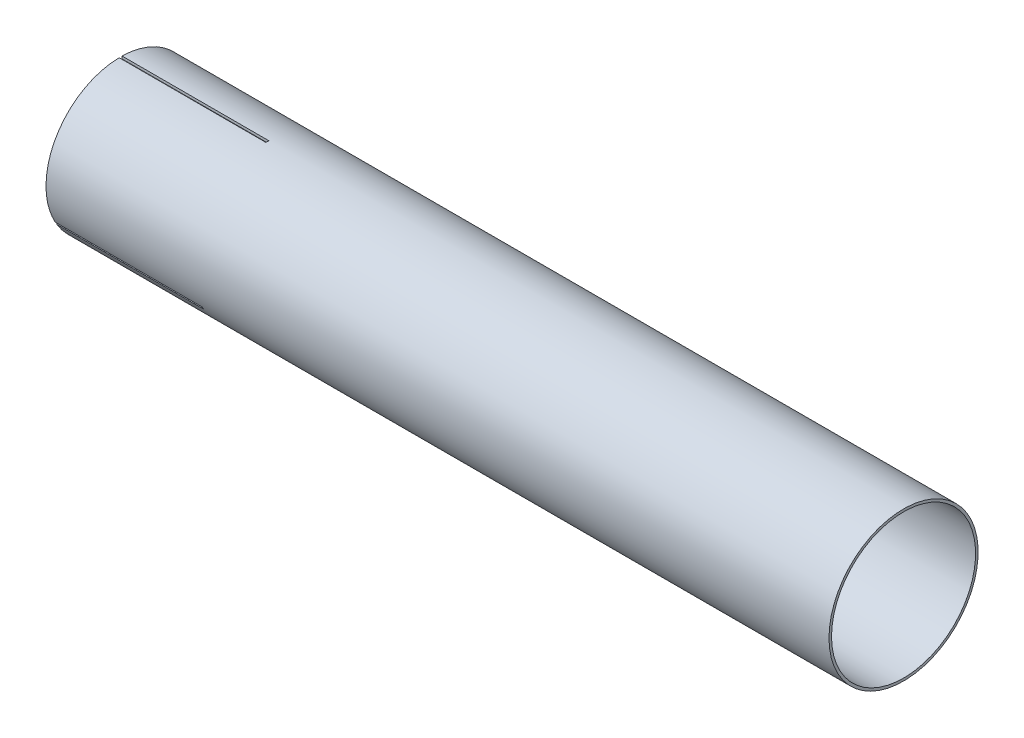
from build123d import *

# Parameters (mm, degrees)
ESQUISSE1_W                  = 800
ESQUISSE1_H                  = 2.5908
ESQUISSE2_W                  = 150
ESQUISSE2_H                  = 3
ENL_V_MAT_EXTRU_1_DEPTH      = 808.225420809
R_P_TITION_CIRCULAIRE1_COUNT = 3
R_P_TITION_CIRCULAIRE1_ANGLE = 240


with BuildPart() as part:
    # Esquisse1 → Révolution1 (revolve)
    with BuildSketch(Plane.XY):
        with Locations((400, 74.9046)):
            Rectangle(ESQUISSE1_W, ESQUISSE1_H)
    revolve(axis=Axis((0, 0, 0), (1, 0, 0)))

    # Esquisse2 → Enlèv. mat.-Extru.1 (cut, through all)
    with BuildSketch(Plane(origin=(0, 0, 0), x_dir=(1, 0, 0), z_dir=(0, 1, 0))):
        with Locations((75, 0)):
            Rectangle(ESQUISSE2_W, ESQUISSE2_H)
    enl_v_mat_extru_1 = extrude(amount=ENL_V_MAT_EXTRU_1_DEPTH, mode=Mode.SUBTRACT)

    # Répétition circulaire1: Enlèv. mat.-Extru.1 ×3 about axis
    r_p_tition_circulaire1_axis = Axis((800, 0, 0), (-1, 0, 0))
    for i in range(1, R_P_TITION_CIRCULAIRE1_COUNT):
        add(enl_v_mat_extru_1.rotate(r_p_tition_circulaire1_axis, i * R_P_TITION_CIRCULAIRE1_ANGLE / (R_P_TITION_CIRCULAIRE1_COUNT - 1)), mode=Mode.SUBTRACT)


solid = part.part
